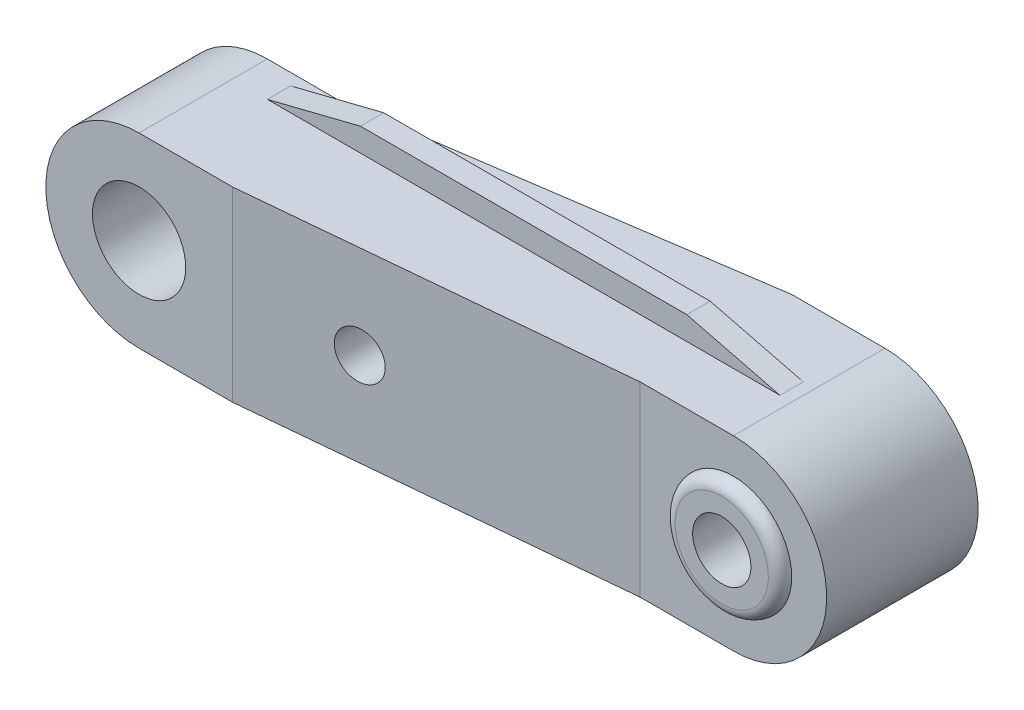
from build123d import *

# Parameters (mm, degrees)
BASE_EXTRUSION_DEPTH    = 4.5
BOSS_EXTRU_1_DEPTH      = 0.5
ENL_V_MAT_EXTRU_1_DEPTH = 30.753151094
ENL_V_MAT_EXTRU_2_DEPTH = 30.753151094
ESQUISSE5_R             = 1.25
ESQUISSE5_R_2           = 1
ENL_V_MAT_EXTRU_3_DEPTH = 30.546573405
ESQUISSE11_R            = 2.5
BOSS_EXTRU_2_DEPTH      = 0.5
CONG_1_R                = 0.5
ESQUISSE12_R            = 1.25
ENL_V_MAT_EXTRU_5_DEPTH = 30.291637032
ESQUISSE13_R            = 2
ENL_V_MAT_EXTRU_6_DEPTH = 30.546573405
ENL_V_MAT_EXTRU_7_DEPTH = 2.5


with BuildPart() as part:
    # Esquisse1 → Base-Extrusion (new, symmetric)
    with BuildSketch(Plane.XY):
        with BuildLine():
            Line((0, 4), (24, 4))
            ThreePointArc((24, 4), (28, 0), (24, -4))
            Line((24, -4), (0, -4))
            ThreePointArc((0, -4), (-4, 0), (0, 4))
        make_face()
    extrude(amount=BASE_EXTRUSION_DEPTH, both=True)

    # Esquisse2 → Boss.-Extru.1 (add, symmetric)
    with BuildSketch(Plane.XY):
        Polygon((5.5, 5), (1.5, 4), (1.5, -4), (5.5, -5), (19.5, -5), (23.5, -4), (23.5, 4), (19.5, 5), align=None)
    extrude(amount=BOSS_EXTRU_1_DEPTH, both=True)

    # Esquisse3 → Enlèv. mat.-Extru.1 (cut, through all)
    with BuildSketch(Plane.XZ.offset(4)):
        Polygon((29, 3), (20, 3), (4.013550136, 4.5), (-6, 4.5), (-6, 6), (29, 6), align=None)
    extrude(amount=-ENL_V_MAT_EXTRU_1_DEPTH, mode=Mode.SUBTRACT)

    # Esquisse4 → Enlèv. mat.-Extru.2 (cut, through all)
    with BuildSketch(Plane.XZ.offset(4)):
        Polygon((-6, -1), (3.145079466, -1), (20, -3.5), (29.207616232, -3.5), (29.207616232, -4.5), (29.207616232, -7.5), (-6, -7.5), align=None)
    extrude(amount=-ENL_V_MAT_EXTRU_2_DEPTH, mode=Mode.SUBTRACT)

    # Esquisse5 → Enlèv. mat.-Extru.3 (cut, through all)
    with BuildSketch(Plane.XY.offset(4.5)):
        with Locations((24, 0)):
            Circle(ESQUISSE5_R)
        with Locations(Location((9, 0, 0), (0, 0, 180))):
            Circle(ESQUISSE5_R_2)
    extrude(amount=-ENL_V_MAT_EXTRU_3_DEPTH, mode=Mode.SUBTRACT)

    # Esquisse11 → Boss.-Extru.2 (add)
    with BuildSketch(Plane.XY.offset(3)):
        with Locations((24, 0)):
            Circle(ESQUISSE11_R)
    extrude(amount=BOSS_EXTRU_2_DEPTH)

    # Congé1
    cong_1_edges = [part.edges().sort_by_distance(p)[0] for p in [
        (21.5, 0, 3.5),
    ]]
    fillet(cong_1_edges, radius=CONG_1_R - 0.0001)  # a hair under: the kernel refuses the full size

    # Esquisse12 → Enlèv. mat.-Extru.5 (cut, through all)
    with BuildSketch(Plane.XY.offset(3.5)):
        with Locations((24, 0)):
            Circle(ESQUISSE12_R)
    extrude(amount=-ENL_V_MAT_EXTRU_5_DEPTH, mode=Mode.SUBTRACT)

    # Esquisse13 → Enlèv. mat.-Extru.6 (cut, through all)
    with BuildSketch(Plane.XY.offset(4.5)):
        Circle(ESQUISSE13_R)
    extrude(amount=-ENL_V_MAT_EXTRU_6_DEPTH, mode=Mode.SUBTRACT)

    # Esquisse14 → Enlèv. mat.-Extru.7 (cut)
    with BuildSketch(Plane(origin=(0, 0, -3.5), x_dir=(-1, 0, 0), z_dir=(0, 0, -1))):
        with BuildLine():
            Line((-2.872281323, 2.5), (-6.127718677, 2.5))
            ThreePointArc((-6.127718677, 2.5), (-6.570921307, 2.231455025), (-6.53804458, 1.714285714))
            ThreePointArc((-6.53804458, 1.714285714), (-6, 0), (-6.53804458, -1.714285714))
            ThreePointArc((-6.53804458, -1.714285714), (-6.570921307, -2.231455025), (-6.127718677, -2.5))
            Line((-6.127718677, -2.5), (-2.872281323, -2.5))
            ThreePointArc((-2.872281323, -2.5), (-2.429078693, -2.231455025), (-2.46195542, -1.714285714))
            ThreePointArc((-2.46195542, -1.714285714), (-3, 0), (-2.46195542, 1.714285714))
            ThreePointArc((-2.46195542, 1.714285714), (-2.429078693, 2.231455025), (-2.872281323, 2.5))
        make_face()
        with BuildLine():
            Line((-11.872281323, -2.5), (-21.127718677, -2.5))
            ThreePointArc((-21.127718677, -2.5), (-21.570921307, -2.231455025), (-21.53804458, -1.714285714))
            ThreePointArc((-21.53804458, -1.714285714), (-21, 0), (-21.53804458, 1.714285714))
            ThreePointArc((-21.53804458, 1.714285714), (-21.570921307, 2.231455025), (-21.127718677, 2.5))
            Line((-21.127718677, 2.5), (-11.872281323, 2.5))
            ThreePointArc((-11.872281323, 2.5), (-11.429078693, 2.231455025), (-11.46195542, 1.714285714))
            ThreePointArc((-11.46195542, 1.714285714), (-12, 0), (-11.46195542, -1.714285714))
            ThreePointArc((-11.46195542, -1.714285714), (-11.429078693, -2.231455025), (-11.872281323, -2.5))
        make_face()
    extrude(amount=-ENL_V_MAT_EXTRU_7_DEPTH, mode=Mode.SUBTRACT)


solid = part.part
